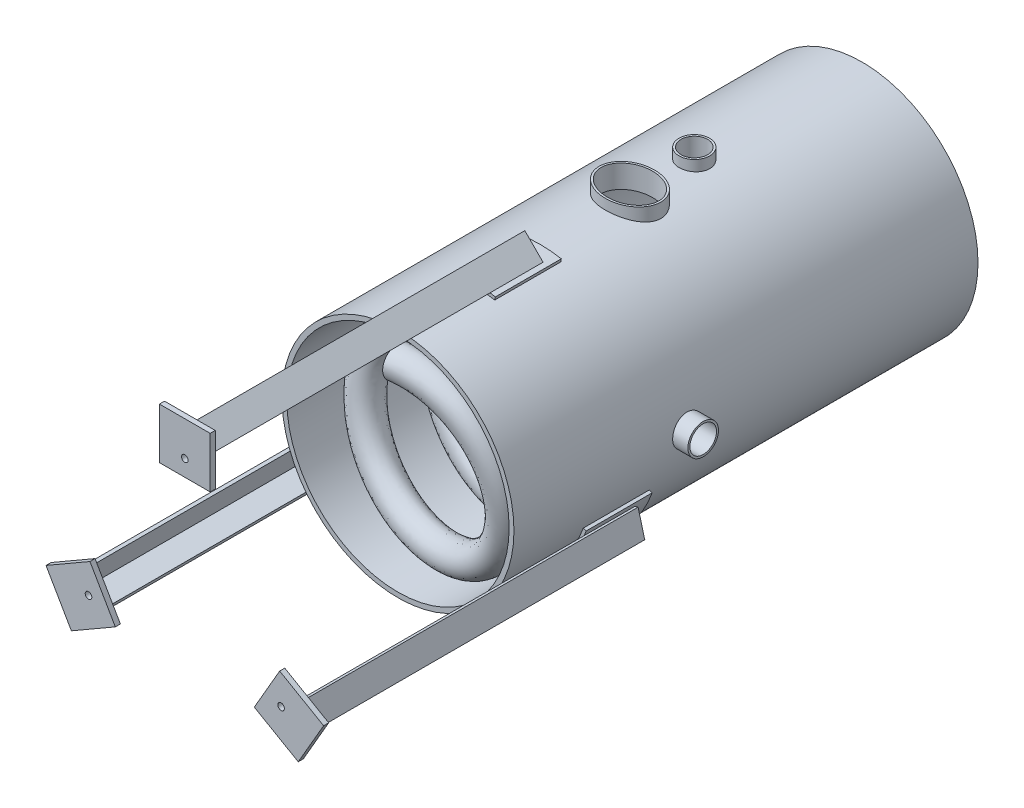
from build123d import *

# Parameters (mm, degrees)
CROQUIS2_R                   = 228.6
SALIENTE_EXTRUIR1_DEPTH      = 457.2
VACIADO1_T                   = -9.525
SALIENTE_EXTRUIR5_DEPTH      = 100
SALIENTE_EXTRUIR5_DEPTH_BACK = 30
SALIENTE_EXTRUIR6_DEPTH      = 670
CROQUIS10_W                  = 100
CROQUIS10_H                  = 100
SALIENTE_EXTRUIR7_DEPTH      = 10
CROQUIS19_RX                 = 60.91
CROQUIS19_RY                 = 48.41
SALIENTE_EXTRUIR10_DEPTH     = 45
CORTAR_EXTRUIR3_REACH        = 1037.384
CROQUIS21_R                  = 30.15
SALIENTE_EXTRUIR11_DEPTH     = 45
CORTAR_EXTRUIR4_REACH        = 1037.384
CROQUIS22_R                  = 26.24
CROQUIS23_R                  = 16.7
SALIENTE_EXTRUIR12_DEPTH     = 50
CORTAR_EXTRUIR5_REACH        = 1070.626
CROQUIS25_R                  = 13.32
CROQUIS27_R                  = 30.15
SALIENTE_EXTRUIR13_DEPTH     = 50
BARRER1_PITCH                = 150
BARRER1_HEIGHT               = 330
BARRER1_RADIUS               = 175
BARRER1_START_ANGLE          = 90
CROQUIS30_R                  = 30.15
CROQUIS33_R                  = 26.24
CORTAR_EXTRUIR6_DEPTH        = 50
CROQUIS35_R                  = 6.5
CORTAR_EXTRUIR7_DEPTH        = 10


with BuildPart() as part:
    # Croquis2 → Saliente-Extruir1 (new, symmetric)
    with BuildSketch(Plane.XY):
        Circle(CROQUIS2_R)
    extrude(amount=SALIENTE_EXTRUIR1_DEPTH, both=True)

    # Vaciado1
    vaciado1_openings = [part.faces().sort_by_distance(p)[0] for p in [
        (0, 0, 457.2),
        (0, 0, -457.2),
    ]]
    offset(amount=VACIADO1_T, openings=vaciado1_openings, kind=Kind.INTERSECTION)

    # Croquis3 → Saliente-Extruir5 (add, two sides: drawn at the far end of the back side and taken through both)
    with BuildSketch(Plane.XY.offset(207.2).offset(-SALIENTE_EXTRUIR5_DEPTH_BACK)):
        with BuildLine():
            ThreePointArc((-40.832600334, 224.923673165), (-20.498881854, 227.679063251), (0, 228.6))
            ThreePointArc((0, 228.6), (20.498881854, 227.679063251), (40.832600334, 224.923673165))
            Line((40.832600334, 224.923673165), (41.904322127, 230.827181647))
            ThreePointArc((41.904322127, 230.827181647), (0, 234.6), (-41.904322127, 230.827181647))
            Line((-41.904322127, 230.827181647), (-40.832600334, 224.923673165))
        make_face()
        with BuildLine():
            ThreePointArc((-174.373314706, -147.823905774), (-186.926411758, -131.59208406), (-197.973407305, -114.3))
            ThreePointArc((-197.973407305, -114.3), (-207.425293612, -96.086979191), (-215.20591504, -77.099767391))
            Line((-215.20591504, -77.099767391), (-220.854364254, -79.123383333))
            ThreePointArc((-220.854364254, -79.123383333), (-203.169559728, -117.3), (-178.950042126, -151.703798314))
            Line((-178.950042126, -151.703798314), (-174.373314706, -147.823905774))
        make_face()
        with BuildLine():
            ThreePointArc((215.20591504, -77.099767391), (207.425293612, -96.086979191), (197.973407305, -114.3))
            ThreePointArc((197.973407305, -114.3), (186.926411758, -131.59208406), (174.373314706, -147.823905774))
            Line((174.373314706, -147.823905774), (178.950042126, -151.703798314))
            ThreePointArc((178.950042126, -151.703798314), (203.169559728, -117.3), (220.854364254, -79.123383333))
            Line((220.854364254, -79.123383333), (215.20591504, -77.099767391))
        make_face()
    extrude(amount=SALIENTE_EXTRUIR5_DEPTH + SALIENTE_EXTRUIR5_DEPTH_BACK)

    # Croquis8 → Saliente-Extruir6 (add)
    with BuildSketch(Plane.XY.offset(207.2)):
        Polygon((-236.34048175, -136.451240759), (-223.194027173, -87.388004338), (-217.01789744, -89.042893313), (-228.509463043, -131.93), (-185.622356355, -143.421565603), (-187.27724533, -149.597695336), align=None)
        Polygon((236.34048175, -136.451240759), (187.27724533, -149.597695336), (185.622356355, -143.421565603), (228.509463043, -131.93), (217.01789744, -89.042893313), (223.194027173, -87.388004338), align=None)
        Polygon((0, 263.86), (-31.395541085, 232.464458915), (-35.916781844, 236.985699674), (0, 272.902481518), (35.916781844, 236.985699674), (31.395541085, 232.464458915), align=None)
    extrude(amount=SALIENTE_EXTRUIR6_DEPTH)

    # Croquis10 → Saliente-Extruir7 (add)
    with BuildSketch(Plane.XY.offset(877.2)):
        Polygon((273.534119436, -100.18997057), (186.931579057, -50.18997057), (136.931579057, -136.792510948), (223.534119436, -186.792510948), align=None)
        with Locations((0, 236.982481518)):
            Rectangle(CROQUIS10_W, CROQUIS10_H)
        Polygon((-223.534119436, -186.792510948), (-136.931579057, -136.792510948), (-186.931579057, -50.18997057), (-273.534119436, -100.18997057), align=None)
    extrude(amount=-SALIENTE_EXTRUIR7_DEPTH)

    # Croquis19 → Saliente-Extruir10 (add)
    with BuildSketch(Plane(origin=(0, 248.6, 0), x_dir=(1, 0, 0), z_dir=(0, 1, 0))):
        with Locations(Location((0, 0), (0, 0, -180))):
            Ellipse(CROQUIS19_RX, CROQUIS19_RY)
    extrude(amount=-SALIENTE_EXTRUIR10_DEPTH)

    # Croquis20 → Cortar-Extruir3 (cut, up to next)
    with BuildSketch(Plane(origin=(0, 248.6, 0), x_dir=(1, 0, 0), z_dir=(0, 1, 0)), mode=Mode.PRIVATE) as cortar_extruir3_sk1:
        with BuildLine():
            add(Edge.make_bspline(
                [(57, 0), (57, 1.6865142), (56.877004601, 3.351266305), (56.398795699, 6.63968319), (56.043527209, 8.26333824), (55.339779241, 10.668592448), (55.076074619, 11.46685069), (54.493898162, 13.04642349), (54.177554857, 13.822339197), (53.156678148, 16.110626337), (52.380540227, 17.583670855), (51.083444292, 19.720251782), (50.62886572, 20.420245369), (49.676329311, 21.796407613), (49.177028379, 22.474256155), (47.625258691, 24.459731276), (46.523421906, 25.714986013), (44.19811368, 28.101924605), (42.974579533, 29.233544754), (41.053759867, 30.844095218), (40.399198371, 31.366429653), (39.062087077, 32.38266469), (38.381990537, 32.874624419), (34.943396613, 35.245434502), (32.055230672, 36.873052571), (27.544404083, 38.964545435), (26.010745029, 39.602824477), (22.88506374, 40.765016218), (21.287279189, 41.290307398), (16.471750759, 42.678215802), (13.220524121, 43.360662236), (8.286530335, 44.044793142), (6.632276844, 44.215871185), (4.13650942, 44.387017028), (3.302185664, 44.429800137), (1.628693211, 44.486583598), (0.790329038, 44.500498327), (-3.384309253, 44.497938321), (-6.69181099, 44.267613539), (-13.24315754, 43.355803002), (-16.487038188, 42.674571225), (-20.498762484, 41.517377383), (-21.300370752, 41.27005012), (-22.891987796, 40.745809261), (-23.680581483, 40.469428587), (-26.024596122, 39.597264851), (-27.558300022, 38.958557657), (-32.069826025, 36.865368389), (-34.959215087, 35.236096872), (-38.400071233, 32.861759823), (-39.081220205, 32.368572412), (-40.416825893, 31.352570463), (-41.070373574, 30.830583773), (-42.987461034, 29.221891398), (-44.207582902, 28.092588477), (-46.524752238, 25.71323456), (-47.621857227, 24.463239997), (-49.680791615, 21.830532229), (-50.646246932, 20.440077588), (-52.381043827, 17.583167712), (-53.156281259, 16.110726993), (-54.51221127, 13.072994935), (-55.092996641, 11.507747884), (-55.804168385, 9.083510932), (-56.012922637, 8.26724976), (-56.369872715, 6.634169267), (-56.51878556, 5.814963984), (-56.877163595, 3.349382418), (-56.998544926, 1.69506536), (-57.000708092, -0.802629042), (-56.971376616, -1.637903083), (-56.851133338, -3.314002645), (-56.75983039, -4.155236521), (-56.398627535, -6.64436893), (-56.041077699, -8.272359012), (-55.105411999, -11.468957172), (-54.527246164, -13.037551795), (-53.154493613, -16.116475018), (-52.372353711, -17.598632129), (-50.639555958, -20.449932873), (-49.688054405, -21.820707744), (-48.141037469, -23.79964401), (-47.604526664, -24.44731995), (-46.495811462, -25.713263878), (-45.926675946, -26.328152991), (-43.011485242, -29.3175395), (-40.4594943, -31.440045624), (-37.033769091, -33.804721578), (-36.336687878, -34.26305119), (-34.919094844, -35.151039779), (-34.196958517, -35.581602247), (-32.008369139, -36.823754997), (-30.52410169, -37.583981791), (-26.001870165, -39.677716211), (-22.895032043, -40.825772636), (-18.108232987, -42.207128886), (-16.491388699, -42.610377461), (-14.034451601, -43.12997345), (-13.209768751, -43.288945548), (-11.562138338, -43.576358525), (-10.737678762, -43.705143667), (-6.612228015, -44.276059854), (-3.301850327, -44.500831757), (1.678330179, -44.499580679), (3.340840079, -44.442436367), (6.67086057, -44.212349094), (8.343975642, -44.038359754), (13.302620108, -43.346122399), (16.542807494, -42.659517229), (22.889320497, -40.826774552), (25.995808162, -39.68119334), (29.784794501, -37.926102359), (30.53885321, -37.558254181), (32.03253866, -36.790643414), (32.769049359, -36.392533505), (34.94719574, -35.154750751), (36.357529385, -34.271740736), (39.090733076, -32.384628741), (40.413631294, -31.380565766), (42.327201063, -29.776480899), (42.953235473, -29.225418325), (44.180416889, -28.088836959), (44.782368805, -27.502492572), (47.717345884, -24.488173546), (49.776260211, -21.87105919), (51.940798559, -18.308605725), (52.353006881, -17.581388325), (53.133692936, -16.095841068), (53.503278587, -15.334712091), (54.527968529, -13.034880623), (55.103417483, -11.473558632), (56.035445476, -8.293795418), (56.392068533, -6.675365683), (56.7539549, -4.202560093), (56.845673226, -3.3707467), (56.968840388, -1.691391179), (57, -0.8432571), (57, 0)],
                knots=[0, 0, 0, 0, 0.015625, 0.015625, 0.03125, 0.03125, 0.0390625, 0.0390625, 0.046875, 0.046875, 0.0625, 0.0625, 0.0703125, 0.0703125, 0.078125, 0.078125, 0.09375, 0.09375, 0.109375, 0.109375, 0.1171875, 0.1171875, 0.125, 0.125, 0.15625, 0.15625, 0.171875, 0.171875, 0.1875, 0.1875, 0.21875, 0.21875, 0.234375, 0.234375, 0.2421875, 0.2421875, 0.25, 0.25, 0.28125, 0.28125, 0.3125, 0.3125, 0.3203125, 0.3203125, 0.328125, 0.328125, 0.34375, 0.34375, 0.375, 0.375, 0.3828125, 0.3828125, 0.390625, 0.390625, 0.40625, 0.40625, 0.421875, 0.421875, 0.4375, 0.4375, 0.453125, 0.453125, 0.46875, 0.46875, 0.4765625, 0.4765625, 0.484375, 0.484375, 0.5, 0.5, 0.5078125, 0.5078125, 0.515625, 0.515625, 0.53125, 0.53125, 0.546875, 0.546875, 0.5625, 0.5625, 0.578125, 0.578125, 0.5859375, 0.5859375, 0.59375, 0.59375, 0.625, 0.625, 0.6328125, 0.6328125, 0.640625, 0.640625, 0.65625, 0.65625, 0.6875, 0.6875, 0.703125, 0.703125, 0.7109375, 0.7109375, 0.71875, 0.71875, 0.75, 0.75, 0.765625, 0.765625, 0.78125, 0.78125, 0.8125, 0.8125, 0.84375, 0.84375, 0.8515625, 0.8515625, 0.859375, 0.859375, 0.875, 0.875, 0.890625, 0.890625, 0.8984375, 0.8984375, 0.90625, 0.90625, 0.9375, 0.9375, 0.9453125, 0.9453125, 0.953125, 0.953125, 0.96875, 0.96875, 0.984375, 0.984375, 0.9921875, 0.9921875, 1, 1, 1, 1], degree=3))
        make_face()
    cortar_extruir3_tool1 = extrude(cortar_extruir3_sk1.sketch, amount=-CORTAR_EXTRUIR3_REACH, mode=Mode.PRIVATE) & part.part
    add(cortar_extruir3_tool1.solids().sort_by_distance((-0.001693, 248.6, -0.002145))[0], mode=Mode.SUBTRACT)

    # Croquis21 → Saliente-Extruir11 (add)
    with BuildSketch(Plane(origin=(0, 248.6, 0), x_dir=(1, 0, 0), z_dir=(0, 1, 0))):
        with Locations(Location((0, 126.8, 0), (0, 0, 270))):
            Circle(CROQUIS21_R)
    extrude(amount=-SALIENTE_EXTRUIR11_DEPTH)

    # Croquis22 → Cortar-Extruir4 (cut, up to next)
    with BuildSketch(Plane(origin=(0, 248.6, 0), x_dir=(1, 0, 0), z_dir=(0, 1, 0)), mode=Mode.PRIVATE) as cortar_extruir4_sk1:
        with Locations(Location((0, 126.8, 0), (0, 0, 270))):
            Circle(CROQUIS22_R)
    cortar_extruir4_tool1 = extrude(cortar_extruir4_sk1.sketch, amount=-CORTAR_EXTRUIR4_REACH, mode=Mode.PRIVATE) & part.part
    add(cortar_extruir4_tool1.solids().sort_by_distance((0, 248.6, -126.8))[0], mode=Mode.SUBTRACT)

    # Croquis23 → Saliente-Extruir12 (add)
    with BuildSketch(Plane(origin=(0, -258.6, 0), x_dir=(-1, 0, 0), z_dir=(0, -1, 0))):
        with Locations(Location((0, 314.325, 0), (0, 0, 90))):
            Circle(CROQUIS23_R)
        with Locations(Location((0, 9.525, 0), (0, 0, 90))):
            Circle(CROQUIS23_R)
    extrude(amount=-SALIENTE_EXTRUIR12_DEPTH)

    # Croquis25 → Cortar-Extruir5 (cut, up to next)
    with BuildSketch(Plane(origin=(0, -258.6, 0), x_dir=(-1, 0, 0), z_dir=(0, -1, 0)), mode=Mode.PRIVATE) as cortar_extruir5_sk1:
        with Locations(Location((0, 314.325, 0), (0, 0, 90))):
            Circle(CROQUIS25_R)
    cortar_extruir5_tool1 = extrude(cortar_extruir5_sk1.sketch, amount=-CORTAR_EXTRUIR5_REACH, mode=Mode.PRIVATE) & part.part
    # Croquis25 → Cortar-Extruir5 (cut, up to next)
    with BuildSketch(Plane(origin=(0, -258.6, 0), x_dir=(-1, 0, 0), z_dir=(0, -1, 0)), mode=Mode.PRIVATE) as cortar_extruir5_sk2:
        with Locations(Location((0, 9.525, 0), (0, 0, 90))):
            Circle(CROQUIS25_R)
    cortar_extruir5_tool2 = extrude(cortar_extruir5_sk2.sketch, amount=-CORTAR_EXTRUIR5_REACH, mode=Mode.PRIVATE) & part.part
    add(cortar_extruir5_tool1.solids().sort_by_distance((0, -258.6, -314.325))[0], mode=Mode.SUBTRACT)
    add(cortar_extruir5_tool2.solids().sort_by_distance((0, -258.6, -9.525))[0], mode=Mode.SUBTRACT)

    # Croquis27 → Saliente-Extruir13 (add)
    with BuildSketch(Plane(origin=(258.6, 0, 0), x_dir=(0, 0, -1), z_dir=(1, 0, 0))):
        with Locations((-114.3, 0)):
            Circle(CROQUIS27_R)
    extrude(amount=-SALIENTE_EXTRUIR13_DEPTH)

    # Croquis33 → Cortar-Extruir6 (cut)
    with BuildSketch(Plane(origin=(258.6, 0, 0), x_dir=(0, 0, -1), z_dir=(1, 0, 0))):
        with Locations((-114.3, 0)):
            Circle(CROQUIS33_R)
    extrude(amount=-CORTAR_EXTRUIR6_DEPTH, mode=Mode.SUBTRACT)

    # Croquis35 → Cortar-Extruir7 (cut)
    with BuildSketch(Plane.XY.offset(877.2)):
        with Locations((-189.724515334, -109.5375)):
            Circle(CROQUIS35_R)
        with Locations((0, 219.075)):
            Circle(CROQUIS35_R)
        with Locations((189.724515334, -109.5375)):
            Circle(CROQUIS35_R)
    extrude(amount=-CORTAR_EXTRUIR7_DEPTH, mode=Mode.SUBTRACT)


with BuildPart() as body_2:
    # Barrer1: sweep along a helix
    with BuildLine() as barrer1_path:
        add(Helix(BARRER1_PITCH, BARRER1_HEIGHT, BARRER1_RADIUS, center=(0, 0, 457.2), direction=(0, 0, -1), mode=Mode.PRIVATE).rotate(Axis((0, 0, 457.2), (0, 0, -1)), BARRER1_START_ANGLE))
    # Croquis30 → Barrer1 (sweep)
    with BuildSketch(Plane(origin=(0, 0, 0), x_dir=(0, 0, -1), z_dir=(1, 0, 0))):
        with Locations((-157.200227483, 174.999962086)):
            Circle(CROQUIS30_R)
    sweep(path=barrer1_path.line, is_frenet=True)


solid = Compound([part.part, body_2.part])
